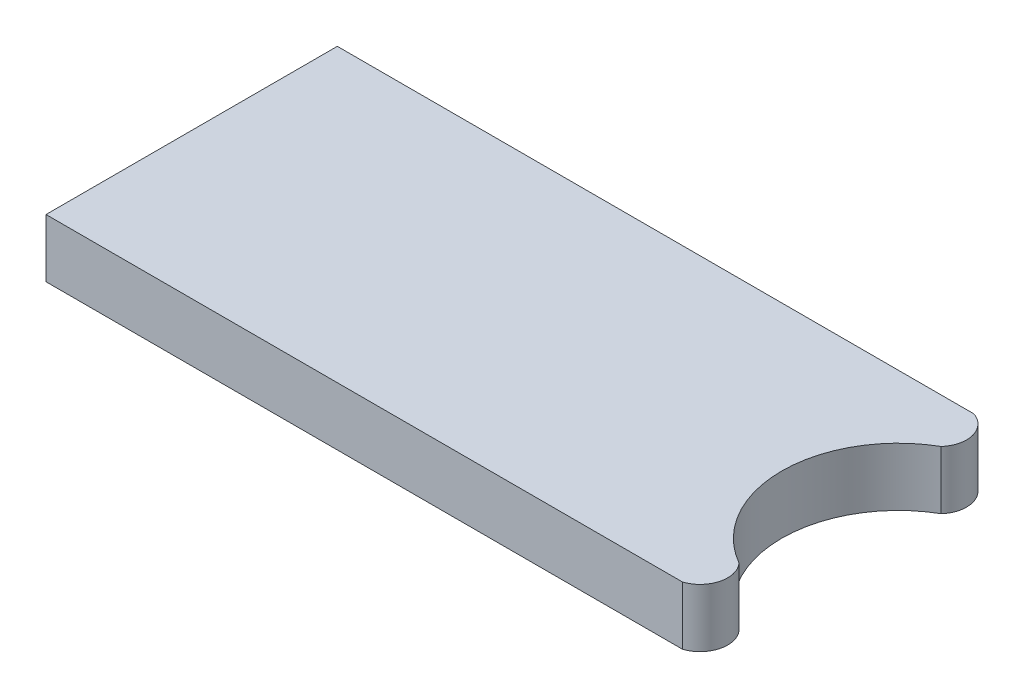
from build123d import *

# Parameters (mm, degrees)
BOSS_EXTRUDE1_DEPTH = 6.35


with BuildPart() as part:
    # Sketch2 → Boss-Extrude1 (new body)
    with BuildSketch(Plane(origin=(0, 0, 0), x_dir=(1, 0, 0), z_dir=(0, 1, 0))):
        with BuildLine():
            Line((0, 31.75), (0, 0))
            Line((0, 0), (67.4751, 0))
            Line((67.4751, 0), (69.3801, 0))
            ThreePointArc((69.3801, 0), (71.337966764, 2.081402196), (70.676448548, 4.861307054))
            ThreePointArc((70.676448548, 4.861307054), (70.015219767, 5.268330017), (69.3801, 5.715))
            ThreePointArc((69.3801, 5.715), (64.3001, 15.875), (69.3801, 26.035))
            ThreePointArc((69.3801, 26.035), (70.015219767, 26.481669983), (70.676448548, 26.888692946))
            ThreePointArc((70.676448548, 26.888692946), (71.337966764, 29.668597804), (69.3801, 31.75))
            Line((69.3801, 31.75), (67.4751, 31.75))
            Line((67.4751, 31.75), (0, 31.75))
        make_face()
    extrude(amount=BOSS_EXTRUDE1_DEPTH)


solid = part.part
